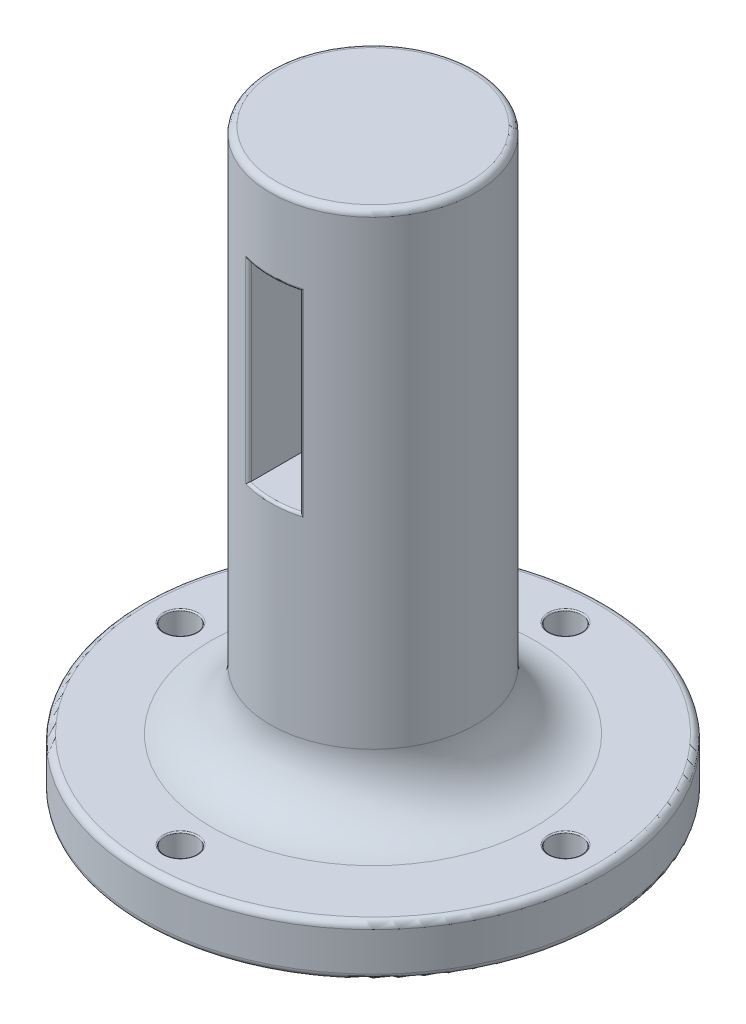
from build123d import *

# Parameters (mm, degrees)
SKETCH_3_R               = 1.25
CUT_EXTRUDE_1_DEPTH      = 52.701063819
FILLET_3_R               = 0.5
FILLET_4_R               = 4.6
FILLET_6_R               = 0.1
FILLET_7_R               = 0.1
CUT_EXTRUDE_3_DEPTH      = 52.701063888
CUT_EXTRUDE_3_DEPTH_BACK = 52.701063888
SKETCH_5_W               = 4
SKETCH_5_H               = 15
FILLET_10_R              = 0.2
FILLET_11_R              = 0.2


with BuildPart() as part:
    # ｽｹｯﾁ1 → 回転1 (revolve)
    with BuildSketch(Plane.XY):
        Polygon((0, 0), (-18, 0), (-18, 4), (-8, 4), (-8, 45), (0, 45), align=None)
    revolve(axis=Axis((0, 45, 0), (0, -1, 0)))

    # ｽｹｯﾁ3 → ｶｯﾄ - 押し出し1 (cut, through all)
    with BuildSketch(Plane.XZ):
        with Locations((0, 15)):
            Circle(SKETCH_3_R)
        with Locations((15, 0)):
            Circle(SKETCH_3_R)
        with Locations((0, -15)):
            Circle(SKETCH_3_R)
        with Locations((-15, 0)):
            Circle(SKETCH_3_R)
    extrude(amount=-CUT_EXTRUDE_1_DEPTH, mode=Mode.SUBTRACT)

    # ﾌｨﾚｯﾄ3
    fillet_3_edges = [part.edges().sort_by_distance(p)[0] for p in [
        (8, 45, 0),
        (18, 4, 0),
        (18, 0, 0),
    ]]
    fillet(fillet_3_edges, radius=FILLET_3_R)

    # ﾌｨﾚｯﾄ4
    fillet_4_edges = [part.edges().sort_by_distance(p)[0] for p in [
        (8, 4, 0),
    ]]
    fillet(fillet_4_edges, radius=FILLET_4_R)

    # ﾌｨﾚｯﾄ6
    fillet_6_edges = [part.edges().sort_by_distance(p)[0] for p in [
        (-1.25, 4, 15),
        (13.75, 4, 0),
        (-1.25, 4, -15),
        (-16.25, 4, 0),
    ]]
    fillet(fillet_6_edges, radius=FILLET_6_R)

    # ﾌｨﾚｯﾄ7
    fillet_7_edges = [part.edges().sort_by_distance(p)[0] for p in [
        (-1.25, 0, 15),
        (13.75, 0, 0),
        (-1.25, 0, -15),
        (-16.25, 0, 0),
    ]]
    fillet(fillet_7_edges, radius=FILLET_7_R)

    # ｽｹｯﾁ5 → ｶｯﾄ - 押し出し3 (cut, two sides: drawn at the far end of the back side and taken through both)
    with BuildSketch(Plane.XY.offset(-CUT_EXTRUDE_3_DEPTH_BACK)):
        with Locations((0, 31.266323704)):
            Rectangle(SKETCH_5_W, SKETCH_5_H)
    extrude(amount=CUT_EXTRUDE_3_DEPTH + CUT_EXTRUDE_3_DEPTH_BACK, mode=Mode.SUBTRACT)

    # ﾌｨﾚｯﾄ10
    # the kernel refuses this fillet: 0.2 mm, written as the material it takes off along each edge
    with BuildSketch(Plane(origin=(0, 23.766323704, 0), x_dir=(-0.30999032218049516, 0, 0.9507397120949733), z_dir=(-0.9507397120949733, 0, -0.30999032218049516))) as fillet_10_piece_1_section:
        with BuildLine():
            CenterArc((8 - FILLET_10_R, -FILLET_10_R), FILLET_10_R, 0, 90)
            Line((8 - FILLET_10_R, 0), (8, 0))
            Line((8, 0), (8, -FILLET_10_R))
        make_face()
    fillet_10_piece_1 = revolve(axis=Axis((0, 23.766323704, 0), (0, 1, 0)), revolution_arc=36.117294523, mode=Mode.PRIVATE)
    fillet_10_piece_1 = split(fillet_10_piece_1, bisect_by=Plane(origin=(-2, 23.71018812, 7.943864416), z_dir=(1, 0, 0)), keep=Keep.TOP, mode=Mode.PRIVATE)
    fillet_10_piece_1 = split(fillet_10_piece_1, bisect_by=Plane(origin=(2, 23.71018812, 7.943864416), z_dir=(-1, 0, 0)), keep=Keep.TOP, mode=Mode.PRIVATE)
    add(fillet_10_piece_1, mode=Mode.SUBTRACT)
    with BuildSketch(Plane(origin=(2, 23.766323704, 7.745966692), x_dir=(0.9639558045611313, 0, -0.2660624115746191), z_dir=(0, 1, 0))) as fillet_10_piece_2:
        with BuildLine():
            CenterArc((0.262672964, 0.199972359), FILLET_10_R, 164.56990898, 106.382669854)
            Line((0.069881803, 0.253184842), (0, 0))
            ThreePointArc((0, 0), (0.132998969, -0.001105622), (0.265997938, 0))
        make_face()
    extrude(amount=15, mode=Mode.SUBTRACT)
    with BuildSketch(Plane(origin=(0, 38.766323704, 0), x_dir=(-0.3099903221804958, 0, 0.9507397120949732), z_dir=(-0.9507397120949732, 0, -0.3099903221804958))) as fillet_10_piece_3_section:
        with BuildLine():
            CenterArc((8 - FILLET_10_R, FILLET_10_R), FILLET_10_R, 270, 90)
            Line((8 - FILLET_10_R, 0), (8, 0))
            Line((8, 0), (8, FILLET_10_R))
        make_face()
    fillet_10_piece_3 = revolve(axis=Axis((0, 38.766323704, 0), (0, 1, 0)), revolution_arc=36.117294523, mode=Mode.PRIVATE)
    fillet_10_piece_3 = split(fillet_10_piece_3, bisect_by=Plane(origin=(-2, 38.822459288, 7.943864416), z_dir=(1, 0, 0)), keep=Keep.TOP, mode=Mode.PRIVATE)
    fillet_10_piece_3 = split(fillet_10_piece_3, bisect_by=Plane(origin=(2, 38.822459288, 7.943864416), z_dir=(-1, 0, 0)), keep=Keep.TOP, mode=Mode.PRIVATE)
    add(fillet_10_piece_3, mode=Mode.SUBTRACT)
    with BuildSketch(Plane(origin=(-2, 23.766323704, 7.745966692), x_dir=(-0.9639558045611314, 0, -0.26606241157461874), z_dir=(0, 1, 0))) as fillet_10_piece_4:
        with BuildLine():
            CenterArc((0.262672964, -0.199972359), FILLET_10_R, 89.047421166, 106.382669854)
            Line((0.069881803, -0.253184842), (0, 0))
            ThreePointArc((0, 0), (0.132998969, 0.001105622), (0.265997938, 0))
        make_face()
    extrude(amount=15, mode=Mode.SUBTRACT)
    with BuildSketch(Plane(origin=(0, 23.766323704, 0), x_dir=(-0.30999032218049516, 0, 0.9507397120949733), z_dir=(-0.9507397120949733, 0, -0.30999032218049516))) as fillet_10_piece_5a_section:
        with BuildLine():
            CenterArc((8 - FILLET_10_R, -FILLET_10_R), FILLET_10_R, 0, 90)
            Line((8 - FILLET_10_R, 0), (8, 0))
            Line((8, 0), (8, -FILLET_10_R))
        make_face()
    fillet_10_piece_5a = revolve(axis=Axis((0, 23.766323704, 0), (0, 1, 0)), revolution_arc=36.117294523, mode=Mode.PRIVATE)
    fillet_10_piece_5a = split(fillet_10_piece_5a, bisect_by=Plane(origin=(-2, 23.720318968, 7.634620405), z_dir=(-1, 0, 0)), keep=Keep.TOP, mode=Mode.PRIVATE)
    with BuildSketch(Plane(origin=(-2, 23.101328859, 7.745966692), x_dir=(-0.9639558045611316, 0, -0.26606241157461835), z_dir=(0, 1, 0))) as fillet_10_piece_5b_section:
        with BuildLine():
            CenterArc((0.262672964, -0.199972359), FILLET_10_R, 89.047421166, 106.382669854)
            Line((0.069881803, -0.253184842), (0, 0))
            ThreePointArc((0, 0), (0.132998969, 0.001105622), (0.265997938, 0))
        make_face()
    fillet_10_piece_5b = extrude(amount=15.664994845, mode=Mode.PRIVATE)
    fillet_10_piece_5b = split(fillet_10_piece_5b, bisect_by=Plane(origin=(-2.06034874, 23.766323704, 7.668384539), z_dir=(0, -1, 0)), keep=Keep.TOP, mode=Mode.PRIVATE)
    fillet_10_piece_5 = fillet_10_piece_5a & fillet_10_piece_5b
    add(fillet_10_piece_5, mode=Mode.SUBTRACT)
    with BuildSketch(Plane(origin=(2, 23.101328859, 7.745966692), x_dir=(0.9639558045611314, 0, -0.26606241157461874), z_dir=(0, 1, 0))) as fillet_10_piece_6a_section:
        with BuildLine():
            CenterArc((0.262672964, 0.199972359), FILLET_10_R, 164.56990898, 106.382669854)
            Line((0.069881803, 0.253184842), (0, 0))
            ThreePointArc((0, 0), (0.132998969, -0.001105622), (0.265997938, 0))
        make_face()
    fillet_10_piece_6a = extrude(amount=15.664994845, mode=Mode.PRIVATE)
    fillet_10_piece_6a = split(fillet_10_piece_6a, bisect_by=Plane(origin=(2.06034874, 23.766323704, 7.668384539), z_dir=(0, -1, 0)), keep=Keep.TOP, mode=Mode.PRIVATE)
    with BuildSketch(Plane(origin=(0, 23.766323704, 0), x_dir=(-0.30999032218049516, 0, 0.9507397120949733), z_dir=(-0.9507397120949733, 0, -0.30999032218049516))) as fillet_10_piece_6b_section:
        with BuildLine():
            CenterArc((8 - FILLET_10_R, -FILLET_10_R), FILLET_10_R, 0, 90)
            Line((8 - FILLET_10_R, 0), (8, 0))
            Line((8, 0), (8, -FILLET_10_R))
        make_face()
    fillet_10_piece_6b = revolve(axis=Axis((0, 23.766323704, 0), (0, 1, 0)), revolution_arc=36.117294523, mode=Mode.PRIVATE)
    fillet_10_piece_6b = split(fillet_10_piece_6b, bisect_by=Plane(origin=(2, 23.72031891, 7.634620664), z_dir=(1, 0, 0)), keep=Keep.TOP, mode=Mode.PRIVATE)
    fillet_10_piece_6 = fillet_10_piece_6a & fillet_10_piece_6b
    add(fillet_10_piece_6, mode=Mode.SUBTRACT)
    with BuildSketch(Plane(origin=(0, 38.766323704, 0), x_dir=(-0.3099903221804958, 0, 0.9507397120949732), z_dir=(-0.9507397120949732, 0, -0.3099903221804958))) as fillet_10_piece_7a_section:
        with BuildLine():
            CenterArc((8 - FILLET_10_R, FILLET_10_R), FILLET_10_R, 270, 90)
            Line((8 - FILLET_10_R, 0), (8, 0))
            Line((8, 0), (8, FILLET_10_R))
        make_face()
    fillet_10_piece_7a = revolve(axis=Axis((0, 38.766323704, 0), (0, 1, 0)), revolution_arc=36.117294523, mode=Mode.PRIVATE)
    fillet_10_piece_7a = split(fillet_10_piece_7a, bisect_by=Plane(origin=(2, 38.812328495, 7.634620662), z_dir=(1, 0, 0)), keep=Keep.TOP, mode=Mode.PRIVATE)
    with BuildSketch(Plane(origin=(2, 23.766323704, 7.745966692), x_dir=(0.9639558045611313, 0, -0.2660624115746191), z_dir=(0, 1, 0))) as fillet_10_piece_7b_section:
        with BuildLine():
            CenterArc((0.262672964, 0.199972359), FILLET_10_R, 164.56990898, 106.382669854)
            Line((0.069881803, 0.253184842), (0, 0))
            ThreePointArc((0, 0), (0.132998969, -0.001105622), (0.265997938, 0))
        make_face()
    fillet_10_piece_7b = extrude(amount=15.664994845, mode=Mode.PRIVATE)
    fillet_10_piece_7b = split(fillet_10_piece_7b, bisect_by=Plane(origin=(2.06034874, 38.766323704, 7.668384539), z_dir=(0, 1, 0)), keep=Keep.TOP, mode=Mode.PRIVATE)
    fillet_10_piece_7 = fillet_10_piece_7a & fillet_10_piece_7b
    add(fillet_10_piece_7, mode=Mode.SUBTRACT)
    with BuildSketch(Plane(origin=(0, 38.766323704, 0), x_dir=(-0.3099903221804958, 0, 0.9507397120949732), z_dir=(-0.9507397120949732, 0, -0.3099903221804958))) as fillet_10_piece_8a_section:
        with BuildLine():
            CenterArc((8 - FILLET_10_R, FILLET_10_R), FILLET_10_R, 270, 90)
            Line((8 - FILLET_10_R, 0), (8, 0))
            Line((8, 0), (8, FILLET_10_R))
        make_face()
    fillet_10_piece_8a = revolve(axis=Axis((0, 38.766323704, 0), (0, 1, 0)), revolution_arc=36.117294523, mode=Mode.PRIVATE)
    fillet_10_piece_8a = split(fillet_10_piece_8a, bisect_by=Plane(origin=(-2, 38.812328443, 7.634620407), z_dir=(-1, 0, 0)), keep=Keep.TOP, mode=Mode.PRIVATE)
    with BuildSketch(Plane(origin=(-2, 23.766323704, 7.745966692), x_dir=(-0.9639558045611314, 0, -0.26606241157461874), z_dir=(0, 1, 0))) as fillet_10_piece_8b_section:
        with BuildLine():
            CenterArc((0.262672964, -0.199972359), FILLET_10_R, 89.047421166, 106.382669854)
            Line((0.069881803, -0.253184842), (0, 0))
            ThreePointArc((0, 0), (0.132998969, 0.001105622), (0.265997938, 0))
        make_face()
    fillet_10_piece_8b = extrude(amount=15.664994845, mode=Mode.PRIVATE)
    fillet_10_piece_8b = split(fillet_10_piece_8b, bisect_by=Plane(origin=(-2.06034874, 38.766323704, 7.668384539), z_dir=(0, 1, 0)), keep=Keep.TOP, mode=Mode.PRIVATE)
    fillet_10_piece_8 = fillet_10_piece_8a & fillet_10_piece_8b
    add(fillet_10_piece_8, mode=Mode.SUBTRACT)

    # ﾌｨﾚｯﾄ11
    # the kernel refuses this fillet: 0.2 mm, written as the material it takes off along each edge
    with BuildSketch(Plane(origin=(0, 23.766323704, 0), x_dir=(0.30999032218049505, 0, -0.9507397120949734), z_dir=(0.9507397120949734, 0, 0.30999032218049505))) as fillet_11_piece_1_section:
        with BuildLine():
            CenterArc((8 - FILLET_11_R, -FILLET_11_R), FILLET_11_R, 0, 90)
            Line((8 - FILLET_11_R, 0), (8, 0))
            Line((8, 0), (8, -FILLET_11_R))
        make_face()
    fillet_11_piece_1 = revolve(axis=Axis((0, 23.766323704, 0), (0, 1, 0)), revolution_arc=36.117294523, mode=Mode.PRIVATE)
    fillet_11_piece_1 = split(fillet_11_piece_1, bisect_by=Plane(origin=(-2, 23.71018812, -7.943864416), z_dir=(1, 0, 0)), keep=Keep.TOP, mode=Mode.PRIVATE)
    fillet_11_piece_1 = split(fillet_11_piece_1, bisect_by=Plane(origin=(2, 23.71018812, -7.943864416), z_dir=(-1, 0, 0)), keep=Keep.TOP, mode=Mode.PRIVATE)
    add(fillet_11_piece_1, mode=Mode.SUBTRACT)
    with BuildSketch(Plane(origin=(2, 23.766323704, -7.745966692), x_dir=(0.9639558045611308, 0, 0.2660624115746208), z_dir=(0, 1, 0))) as fillet_11_piece_2:
        with BuildLine():
            CenterArc((0.262672964, -0.199972359), FILLET_11_R, 89.047421166, 106.382669854)
            Line((0.069881803, -0.253184842), (0, 0))
            ThreePointArc((0, 0), (0.132998969, 0.001105622), (0.265997938, 0))
        make_face()
    extrude(amount=15, mode=Mode.SUBTRACT)
    with BuildSketch(Plane(origin=(0, 38.766323704, 0), x_dir=(0.30999032218049594, 0, -0.9507397120949731), z_dir=(0.9507397120949731, 0, 0.30999032218049594))) as fillet_11_piece_3_section:
        with BuildLine():
            CenterArc((8 - FILLET_11_R, FILLET_11_R), FILLET_11_R, 270, 90)
            Line((8 - FILLET_11_R, 0), (8, 0))
            Line((8, 0), (8, FILLET_11_R))
        make_face()
    fillet_11_piece_3 = revolve(axis=Axis((0, 38.766323704, 0), (0, 1, 0)), revolution_arc=36.117294523, mode=Mode.PRIVATE)
    fillet_11_piece_3 = split(fillet_11_piece_3, bisect_by=Plane(origin=(-2, 38.822459288, -7.943864416), z_dir=(1, 0, 0)), keep=Keep.TOP, mode=Mode.PRIVATE)
    fillet_11_piece_3 = split(fillet_11_piece_3, bisect_by=Plane(origin=(2, 38.822459288, -7.943864416), z_dir=(-1, 0, 0)), keep=Keep.TOP, mode=Mode.PRIVATE)
    add(fillet_11_piece_3, mode=Mode.SUBTRACT)
    with BuildSketch(Plane(origin=(-2, 23.766323704, -7.745966692), x_dir=(-0.963955804561131, 0, 0.26606241157462), z_dir=(0, 1, 0))) as fillet_11_piece_4:
        with BuildLine():
            CenterArc((0.262672964, 0.199972359), FILLET_11_R, 164.56990898, 106.382669854)
            Line((0.069881803, 0.253184842), (0, 0))
            ThreePointArc((0, 0), (0.132998969, -0.001105622), (0.265997938, 0))
        make_face()
    extrude(amount=15, mode=Mode.SUBTRACT)
    with BuildSketch(Plane(origin=(2, 23.101328859, -7.745966692), x_dir=(0.9639558045611316, 0, 0.2660624115746186), z_dir=(0, 1, 0))) as fillet_11_piece_5a_section:
        with BuildLine():
            CenterArc((0.262672964, -0.199972359), FILLET_11_R, 89.047421166, 106.382669854)
            Line((0.069881803, -0.253184842), (0, 0))
            ThreePointArc((0, 0), (0.132998969, 0.001105622), (0.265997938, 0))
        make_face()
    fillet_11_piece_5a = extrude(amount=15.664994845, mode=Mode.PRIVATE)
    fillet_11_piece_5a = split(fillet_11_piece_5a, bisect_by=Plane(origin=(2.06034874, 23.766323704, -7.668384539), z_dir=(0, -1, 0)), keep=Keep.TOP, mode=Mode.PRIVATE)
    with BuildSketch(Plane(origin=(0, 23.766323704, 0), x_dir=(0.30999032218049505, 0, -0.9507397120949734), z_dir=(0.9507397120949734, 0, 0.30999032218049505))) as fillet_11_piece_5b_section:
        with BuildLine():
            CenterArc((8 - FILLET_11_R, -FILLET_11_R), FILLET_11_R, 0, 90)
            Line((8 - FILLET_11_R, 0), (8, 0))
            Line((8, 0), (8, -FILLET_11_R))
        make_face()
    fillet_11_piece_5b = revolve(axis=Axis((0, 23.766323704, 0), (0, 1, 0)), revolution_arc=36.117294523, mode=Mode.PRIVATE)
    fillet_11_piece_5b = split(fillet_11_piece_5b, bisect_by=Plane(origin=(2, 23.720318965, -7.634620407), z_dir=(1, 0, 0)), keep=Keep.TOP, mode=Mode.PRIVATE)
    fillet_11_piece_5 = fillet_11_piece_5a & fillet_11_piece_5b
    add(fillet_11_piece_5, mode=Mode.SUBTRACT)
    with BuildSketch(Plane(origin=(0, 23.766323704, 0), x_dir=(0.30999032218049505, 0, -0.9507397120949734), z_dir=(0.9507397120949734, 0, 0.30999032218049505))) as fillet_11_piece_6a_section:
        with BuildLine():
            CenterArc((8 - FILLET_11_R, -FILLET_11_R), FILLET_11_R, 0, 90)
            Line((8 - FILLET_11_R, 0), (8, 0))
            Line((8, 0), (8, -FILLET_11_R))
        make_face()
    fillet_11_piece_6a = revolve(axis=Axis((0, 23.766323704, 0), (0, 1, 0)), revolution_arc=36.117294523, mode=Mode.PRIVATE)
    fillet_11_piece_6a = split(fillet_11_piece_6a, bisect_by=Plane(origin=(-2, 23.720318913, -7.634620662), z_dir=(-1, 0, 0)), keep=Keep.TOP, mode=Mode.PRIVATE)
    with BuildSketch(Plane(origin=(-2, 23.101328859, -7.745966692), x_dir=(-0.9639558045611316, 0, 0.2660624115746186), z_dir=(0, 1, 0))) as fillet_11_piece_6b_section:
        with BuildLine():
            CenterArc((0.262672964, 0.199972359), FILLET_11_R, 164.56990898, 106.382669854)
            Line((0.069881803, 0.253184842), (0, 0))
            ThreePointArc((0, 0), (0.132998969, -0.001105622), (0.265997938, 0))
        make_face()
    fillet_11_piece_6b = extrude(amount=15.664994845, mode=Mode.PRIVATE)
    fillet_11_piece_6b = split(fillet_11_piece_6b, bisect_by=Plane(origin=(-2.06034874, 23.766323704, -7.668384539), z_dir=(0, -1, 0)), keep=Keep.TOP, mode=Mode.PRIVATE)
    fillet_11_piece_6 = fillet_11_piece_6a & fillet_11_piece_6b
    add(fillet_11_piece_6, mode=Mode.SUBTRACT)
    with BuildSketch(Plane(origin=(0, 38.766323704, 0), x_dir=(0.30999032218049594, 0, -0.9507397120949731), z_dir=(0.9507397120949731, 0, 0.30999032218049594))) as fillet_11_piece_7a_section:
        with BuildLine():
            CenterArc((8 - FILLET_11_R, FILLET_11_R), FILLET_11_R, 270, 90)
            Line((8 - FILLET_11_R, 0), (8, 0))
            Line((8, 0), (8, FILLET_11_R))
        make_face()
    fillet_11_piece_7a = revolve(axis=Axis((0, 38.766323704, 0), (0, 1, 0)), revolution_arc=36.117294523, mode=Mode.PRIVATE)
    fillet_11_piece_7a = split(fillet_11_piece_7a, bisect_by=Plane(origin=(2, 38.81232844, -7.634620405), z_dir=(1, 0, 0)), keep=Keep.TOP, mode=Mode.PRIVATE)
    with BuildSketch(Plane(origin=(2, 23.766323704, -7.745966692), x_dir=(0.9639558045611308, 0, 0.2660624115746208), z_dir=(0, 1, 0))) as fillet_11_piece_7b_section:
        with BuildLine():
            CenterArc((0.262672964, -0.199972359), FILLET_11_R, 89.047421166, 106.382669854)
            Line((0.069881803, -0.253184842), (0, 0))
            ThreePointArc((0, 0), (0.132998969, 0.001105622), (0.265997938, 0))
        make_face()
    fillet_11_piece_7b = extrude(amount=15.664994845, mode=Mode.PRIVATE)
    fillet_11_piece_7b = split(fillet_11_piece_7b, bisect_by=Plane(origin=(2.06034874, 38.766323704, -7.668384539), z_dir=(0, 1, 0)), keep=Keep.TOP, mode=Mode.PRIVATE)
    fillet_11_piece_7 = fillet_11_piece_7a & fillet_11_piece_7b
    add(fillet_11_piece_7, mode=Mode.SUBTRACT)
    with BuildSketch(Plane(origin=(0, 38.766323704, 0), x_dir=(0.30999032218049594, 0, -0.9507397120949731), z_dir=(0.9507397120949731, 0, 0.30999032218049594))) as fillet_11_piece_8a_section:
        with BuildLine():
            CenterArc((8 - FILLET_11_R, FILLET_11_R), FILLET_11_R, 270, 90)
            Line((8 - FILLET_11_R, 0), (8, 0))
            Line((8, 0), (8, FILLET_11_R))
        make_face()
    fillet_11_piece_8a = revolve(axis=Axis((0, 38.766323704, 0), (0, 1, 0)), revolution_arc=36.117294523, mode=Mode.PRIVATE)
    fillet_11_piece_8a = split(fillet_11_piece_8a, bisect_by=Plane(origin=(-2, 38.812328498, -7.634620664), z_dir=(-1, 0, 0)), keep=Keep.TOP, mode=Mode.PRIVATE)
    with BuildSketch(Plane(origin=(-2, 23.766323704, -7.745966692), x_dir=(-0.963955804561131, 0, 0.26606241157462), z_dir=(0, 1, 0))) as fillet_11_piece_8b_section:
        with BuildLine():
            CenterArc((0.262672964, 0.199972359), FILLET_11_R, 164.56990898, 106.382669854)
            Line((0.069881803, 0.253184842), (0, 0))
            ThreePointArc((0, 0), (0.132998969, -0.001105622), (0.265997938, 0))
        make_face()
    fillet_11_piece_8b = extrude(amount=15.664994845, mode=Mode.PRIVATE)
    fillet_11_piece_8b = split(fillet_11_piece_8b, bisect_by=Plane(origin=(-2.06034874, 38.766323704, -7.668384539), z_dir=(0, 1, 0)), keep=Keep.TOP, mode=Mode.PRIVATE)
    fillet_11_piece_8 = fillet_11_piece_8a & fillet_11_piece_8b
    add(fillet_11_piece_8, mode=Mode.SUBTRACT)


solid = part.part
